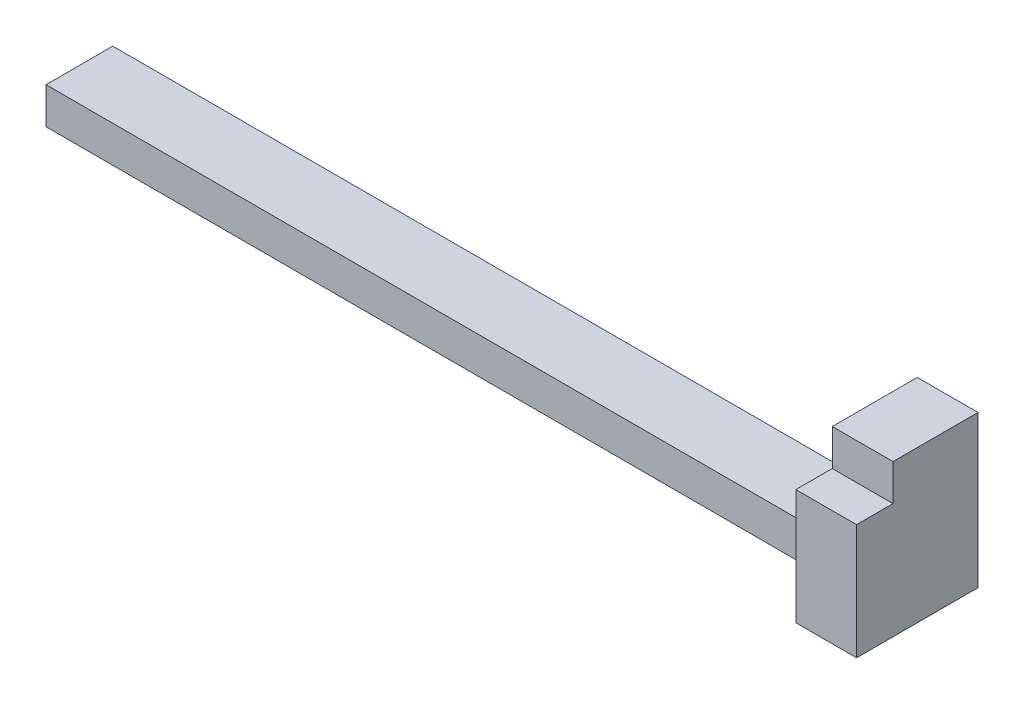
from build123d import *

# Parameters (mm, degrees)
BOSS_EXTRUDE1_START = -73.5
SKETCH1_W           = 11
SKETCH1_H           = 6
BOSS_EXTRUDE1_DEPTH = 128.5
BOSS_EXTRUDE2_DEPTH = 10
SKETCH3_R           = 1.25
BOSS_EXTRUDE3_DEPTH = 4.5
FILLET1_R           = 0.5


with BuildPart() as part:
    # Sketch1 → Boss-Extrude1 (new body)
    with BuildSketch(Plane(origin=(0, 0, 0), x_dir=(0, 0, -1), z_dir=(1, 0, 0)).offset(BOSS_EXTRUDE1_START)):
        with Locations((5.5, -3)):
            Rectangle(SKETCH1_W, SKETCH1_H)
    extrude(amount=BOSS_EXTRUDE1_DEPTH)

    # Sketch2 → Boss-Extrude2 (add)
    with BuildSketch(Plane(origin=(55, 0, 0), x_dir=(0, 0, -1), z_dir=(1, 0, 0))):
        Polygon((1, 15), (15, 15), (15, -10), (-5, -10), (-5, 9), (1, 9), align=None)
    extrude(amount=BOSS_EXTRUDE2_DEPTH)

    # Sketch3 → Boss-Extrude3 (add)
    with BuildSketch(Plane(origin=(0, -6, 0), x_dir=(-1, 0, 0), z_dir=(0, -1, 0))):
        with Locations((-27.5, 5.5)):
            Circle(SKETCH3_R)
    extrude(amount=BOSS_EXTRUDE3_DEPTH)

    # Fillet1
    fillet1_edges = [part.edges().sort_by_distance(p)[0] for p in [
        (28.75, -10.5, -5.5),
    ]]
    fillet(fillet1_edges, radius=FILLET1_R)


solid = part.part
